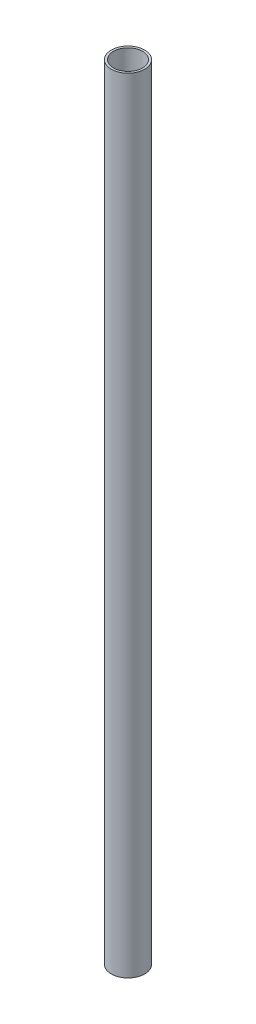
from build123d import *

# Parameters (mm, degrees)
SKETCH1_R           = 10.668
SKETCH1_R_2         = 9.271
BOSS_EXTRUDE1_DEPTH = 501.65


with BuildPart() as part:
    # Sketch1 → Boss-Extrude1 (new body)
    with BuildSketch(Plane(origin=(0, 0, 0), x_dir=(1, 0, 0), z_dir=(0, 1, 0))):
        Circle(SKETCH1_R)
        Circle(SKETCH1_R_2, mode=Mode.SUBTRACT)
    extrude(amount=BOSS_EXTRUDE1_DEPTH)


solid = part.part
